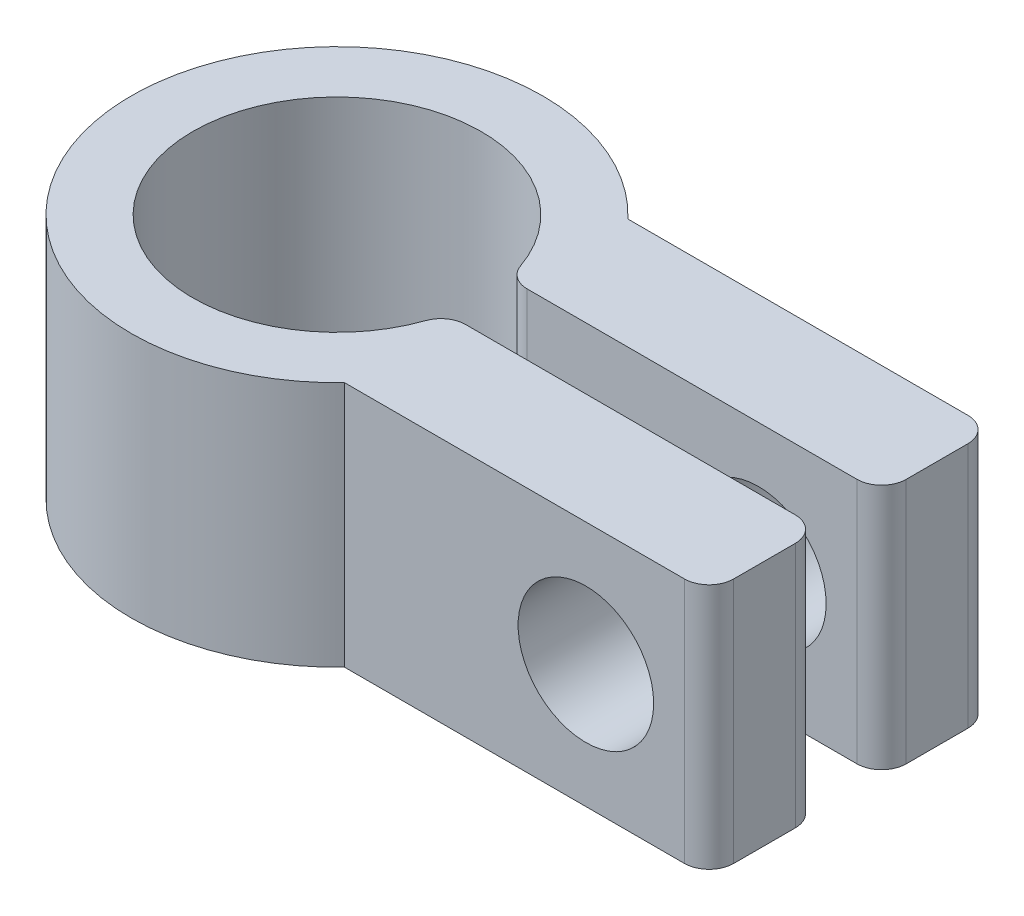
from build123d import *

# Parameters (mm, degrees)
DODANIE_WYCI_GNI_CIE1_DEPTH  = 20
ZAAWANSOWANYOTW_R1_START     = -11.5
ZAAWANSOWANYOTW_R1_OUTLINE_R = 5.5
ZAAWANSOWANYOTW_R1_DEPTH     = 23


# Read off the part's stored shape, not the designer's step: ZaawansowanyOtwór1
with BuildPart() as part:
    # Szkic1 → Dodanie-wyciągnięcie1 (new body)
    with BuildSketch(Plane(origin=(0, 0, 0), x_dir=(1, 0, 0), z_dir=(0, 1, 0))):
        with BuildLine():
            Line((12.109500403, 11.5), (39.7, 11.5))
            ThreePointArc((39.7, 11.5), (41.114213562, 10.914213562), (41.7, 9.5))
            Line((41.7, 9.5), (41.7, 4.5))
            ThreePointArc((41.7, 4.5), (41.114213562, 3.085786438), (39.7, 2.5))
            Line((39.7, 2.5), (13.774977314, 2.5))
            Line((13.774977314, 2.5), (12.939860896, 2.5))
            ThreePointArc((12.939860896, 2.5), (11.780953784, 2.869989477), (11.050830108, 3.843065693))
            ThreePointArc((11.050830108, 3.843065693), (-11.7, 0), (11.050830108, -3.843065693))
            ThreePointArc((11.050830108, -3.843065693), (11.780953784, -2.869989477), (12.939860896, -2.5))
            Line((12.939860896, -2.5), (13.774977314, -2.5))
            Line((13.774977314, -2.5), (39.7, -2.5))
            ThreePointArc((39.7, -2.5), (41.114213562, -3.085786438), (41.7, -4.5))
            Line((41.7, -4.5), (41.7, -9.5))
            ThreePointArc((41.7, -9.5), (41.114213562, -10.914213562), (39.7, -11.5))
            Line((39.7, -11.5), (12.109500403, -11.5))
            ThreePointArc((12.109500403, -11.5), (-16.7, 0), (12.109500403, 11.5))
        make_face()
    extrude(amount=DODANIE_WYCI_GNI_CIE1_DEPTH)

    # ZaawansowanyOtwór1 outline → ZaawansowanyOtwór1 (cut)
    with BuildSketch(Plane.XY.offset(ZAAWANSOWANYOTW_R1_START)):
        with Locations((31.7, 10)):
            Circle(ZAAWANSOWANYOTW_R1_OUTLINE_R)
    extrude(amount=ZAAWANSOWANYOTW_R1_DEPTH, mode=Mode.SUBTRACT)


solid = part.part
